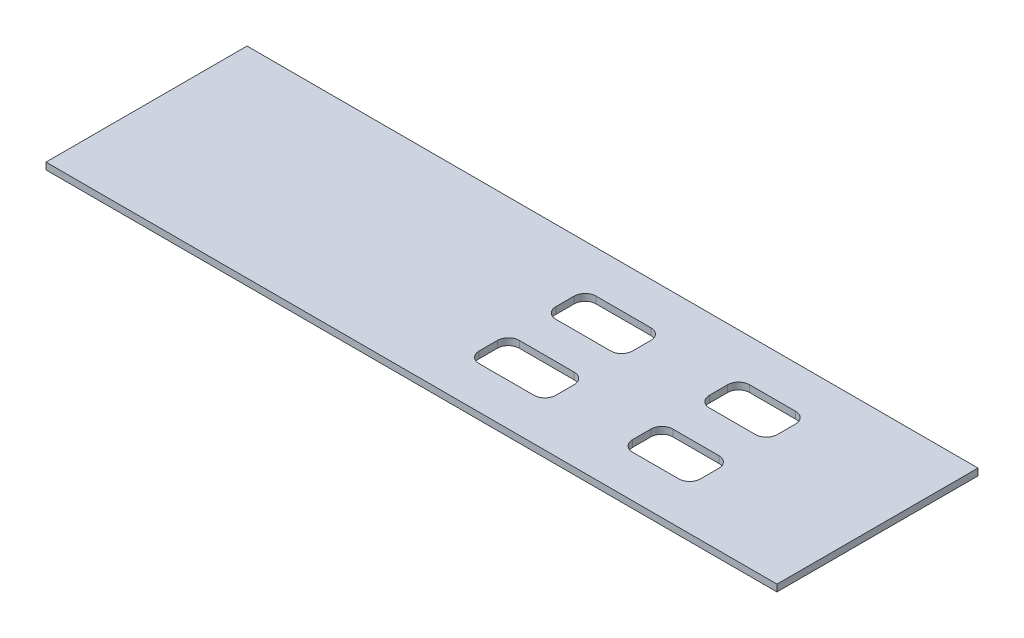
from build123d import *

# Parameters (mm, degrees)
SKETCH1_W           = 152.4
SKETCH1_H           = 69.85
BOSS_EXTRUDE1_DEPTH = 2.3622
SKETCH2_W           = 26.67
SKETCH2_H           = 13.97
SKETCH2_W_2         = 23.622
CUT_EXTRUDE1_DEPTH  = 168.661452006
FILLET1_R           = 3.81
SKETCH4_W           = 69.85
SKETCH4_H           = 2.3622
BOSS_EXTRUDE2_DEPTH = 101.6


with BuildPart() as part:
    # Sketch1 → Boss-Extrude1 (new body)
    with BuildSketch(Plane(origin=(0, 0, 0), x_dir=(1, 0, 0), z_dir=(0, 1, 0))):
        with Locations((76.2, 34.925)):
            Rectangle(SKETCH1_W, SKETCH1_H)
    extrude(amount=BOSS_EXTRUDE1_DEPTH)

    # Sketch2 → Cut-Extrude1 (cut, through all)
    with BuildSketch(Plane(origin=(0, 2.3622, 0), x_dir=(1, 0, 0), z_dir=(0, 1, 0))):
        with Locations((43.815, 48.26)):
            Rectangle(SKETCH2_W, SKETCH2_H)
        with Locations((95.631, 48.26)):
            Rectangle(SKETCH2_W_2, SKETCH2_H)
        with Locations((43.815, 21.59)):
            Rectangle(SKETCH2_W, SKETCH2_H)
        with Locations((95.631, 21.59)):
            Rectangle(SKETCH2_W_2, SKETCH2_H)
    extrude(amount=-CUT_EXTRUDE1_DEPTH, mode=Mode.SUBTRACT)

    # Fillet1
    fillet1_edges = [part.edges().sort_by_distance(p)[0] for p in [
        (83.82, 1.1811, -14.605),
        (83.82, 1.1811, -41.275),
        (30.48, 1.1811, -41.275),
        (30.48, 1.1811, -14.605),
        (107.442, 1.1811, -14.605),
        (57.15, 1.1811, -41.275),
        (57.15, 1.1811, -14.605),
        (107.442, 1.1811, -41.275),
        (107.442, 1.1811, -28.575),
        (107.442, 1.1811, -55.245),
        (57.15, 1.1811, -28.575),
        (57.15, 1.1811, -55.245),
        (30.48, 1.1811, -28.575),
        (83.82, 1.1811, -28.575),
        (83.82, 1.1811, -55.245),
        (30.48, 1.1811, -55.245),
    ]]
    fillet(fillet1_edges, radius=FILLET1_R)

    # Sketch4 → Boss-Extrude2 (add)
    with BuildSketch(Plane.ZY):
        with Locations((-34.925, 1.1811)):
            Rectangle(SKETCH4_W, SKETCH4_H)
    extrude(amount=BOSS_EXTRUDE2_DEPTH)


solid = part.part
